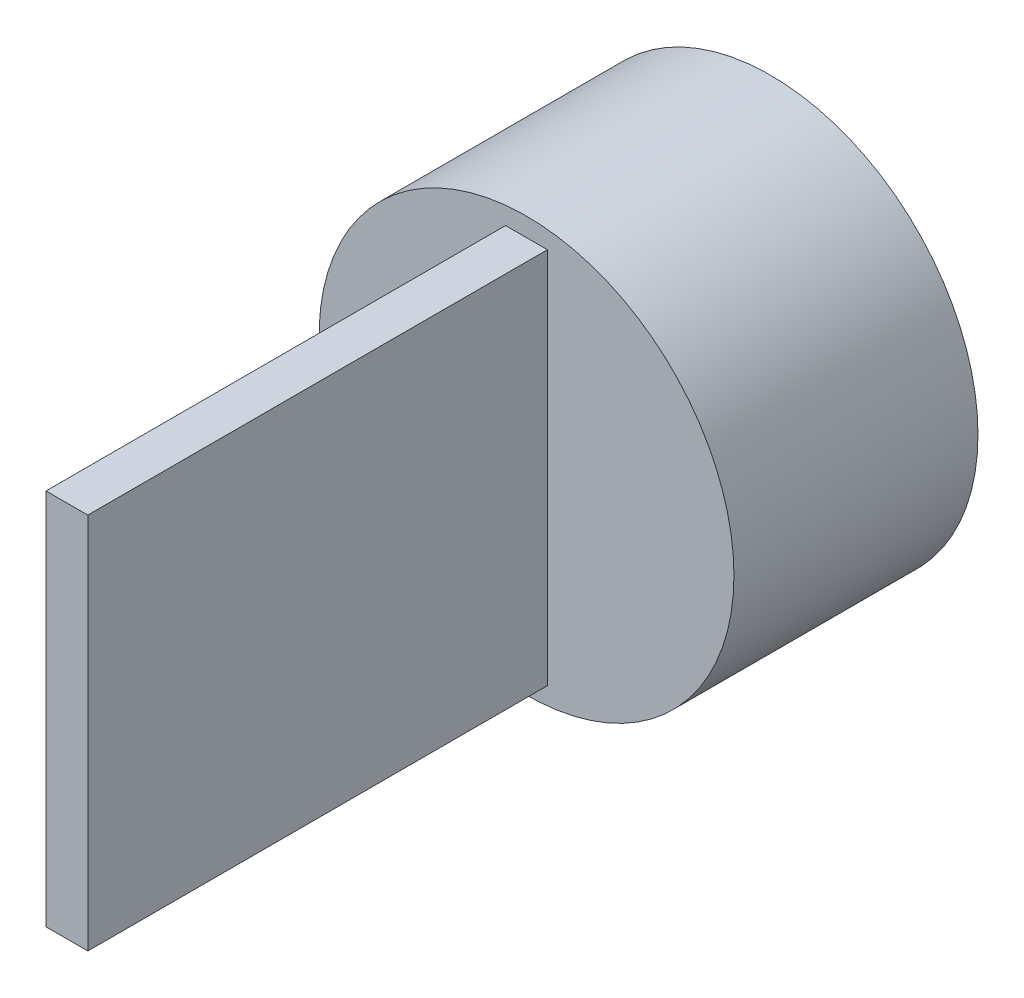
from build123d import *

# Parameters (mm, degrees)
SKIZZE1_R                       = 51
AUFSATZ_LINEAR_AUSTRAGEN1_DEPTH = 60
SKIZZE2_W                       = 10.283106272
SKIZZE2_H                       = 92.818564508
AUFSATZ_LINEAR_AUSTRAGEN2_DEPTH = 113


with BuildPart() as part:
    # Skizze1 → Aufsatz-Linear austragen1 (new body)
    with BuildSketch(Plane.XY):
        Circle(SKIZZE1_R)
    extrude(amount=AUFSATZ_LINEAR_AUSTRAGEN1_DEPTH)

    # Skizze2 → Aufsatz-Linear austragen2 (add)
    with BuildSketch(Plane.XY.offset(60)):
        Rectangle(SKIZZE2_W, SKIZZE2_H)
    extrude(amount=AUFSATZ_LINEAR_AUSTRAGEN2_DEPTH)


solid = part.part
